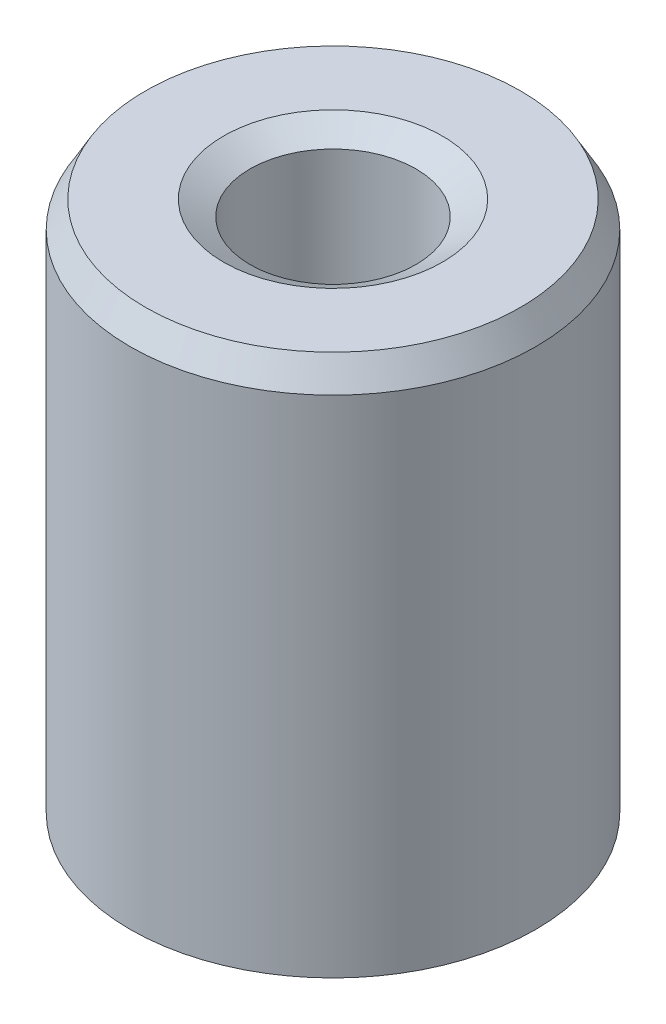
from build123d import *
from OCP.BRepFilletAPI import BRepFilletAPI_MakeChamfer

# Parameters (mm, degrees)
SKETCH1_R           = 20
BOSS_EXTRUDE1_DEPTH = 53.888614116
SKETCH2_R           = 8.180565438
CUT_EXTRUDE1_DEPTH  = 61.860354348
CHAMFER1_SIZE       = 2.60690694
CHAMFER1_SIZE2      = 1.505098424


with BuildPart() as part:
    # Sketch1 → Boss-Extrude1 (new body)
    with BuildSketch(Plane(origin=(0, 0, 0), x_dir=(1, 0, 0), z_dir=(0, 1, 0))):
        Circle(SKETCH1_R)
    extrude(amount=BOSS_EXTRUDE1_DEPTH)

    # Sketch2 → Cut-Extrude1 (cut, through all)
    with BuildSketch(Plane(origin=(0, 0, 0), x_dir=(1, 0, 0), z_dir=(0, 1, 0))):
        Circle(SKETCH2_R)
    extrude(amount=CUT_EXTRUDE1_DEPTH, mode=Mode.SUBTRACT)

    # Chamfer1: one chamfer whose edges measure the first distance from different faces: ONE call of the kernel's chamfer builder (chamfer() names one face for all edges)
    chamfer1_edges_1 = [part.edges().sort_by_distance(p)[0] for p in [
        (-8.180565438, 53.888614116, 0),
    ]]
    chamfer1_side_1 = [part.faces().sort_by_distance(p)[0] for p in [
        (-19.434314575, 53.888614116, 0),
    ]]
    chamfer1_edges_2 = [part.edges().sort_by_distance(p)[0] for p in [
        (-8.180565438, 0, 0),
    ]]
    chamfer1_side_2 = [part.faces().sort_by_distance(p)[0] for p in [
        (-8.180565438, 26.944307058, 0),
    ]]
    chamfer1_edges_3 = [part.edges().sort_by_distance(p)[0] for p in [
        (-20, 0, 0),
    ]]
    chamfer1_side_3 = [part.faces().sort_by_distance(p)[0] for p in [
        (-19.434314575, 0, 0),
    ]]
    chamfer1_edges_4 = [part.edges().sort_by_distance(p)[0] for p in [
        (-20, 53.888614116, 0),
    ]]
    chamfer1_side_4 = [part.faces().sort_by_distance(p)[0] for p in [
        (-20, 26.944307058, 0),
    ]]
    chamfer1 = BRepFilletAPI_MakeChamfer(part.part.solid().wrapped)
    for e in chamfer1_edges_1:
        chamfer1.Add(CHAMFER1_SIZE, CHAMFER1_SIZE2, e.wrapped, chamfer1_side_1[0].wrapped)  # the first distance lies on this face
    for e in chamfer1_edges_2:
        chamfer1.Add(CHAMFER1_SIZE, CHAMFER1_SIZE2, e.wrapped, chamfer1_side_2[0].wrapped)  # the first distance lies on this face
    for e in chamfer1_edges_3:
        chamfer1.Add(CHAMFER1_SIZE, CHAMFER1_SIZE2, e.wrapped, chamfer1_side_3[0].wrapped)  # the first distance lies on this face
    for e in chamfer1_edges_4:
        chamfer1.Add(CHAMFER1_SIZE, CHAMFER1_SIZE2, e.wrapped, chamfer1_side_4[0].wrapped)  # the first distance lies on this face
    add(Compound.cast(chamfer1.Shape()), mode=Mode.REPLACE)


solid = part.part
